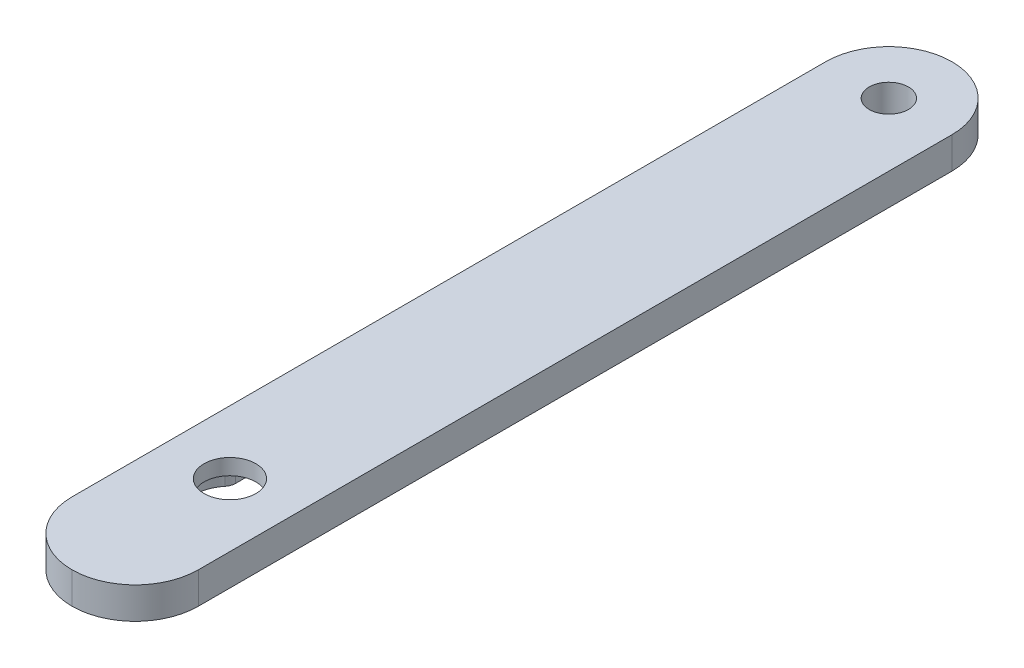
from build123d import *

# Parameters (mm, degrees)
SKETCH1_W           = 15
SKETCH1_H           = 45
BOSS_EXTRUDE1_DEPTH = 2.2
SKETCH1_3_W         = 20
SKETCH1_3_H         = 50
SKETCH1_3_W_2       = 15
SKETCH1_3_H_2       = 45
BOSS_EXTRUDE2_DEPTH = 2.5
SKETCH1_4_W         = 20
SKETCH1_4_H         = 50
SKETCH1_4_R         = 4.1
BOSS_EXTRUDE3_DEPTH = 2.5
FILLET1_R           = 2
SKETCH1_5_R         = 3.1
BOSS_EXTRUDE4_DEPTH = 2.5
FILLET2_R           = 10
SKETCH2_R           = 3.1
CUT_EXTRUDE1_DEPTH  = 4


with BuildPart() as part:
    # Sketch1 → Boss-Extrude1 (new body)
    with BuildSketch(Plane(origin=(0, 0, 0), x_dir=(1, 0, 0), z_dir=(0, 1, 0))):
        Rectangle(SKETCH1_W, SKETCH1_H)
        with BuildLine():
            ThreePointArc((-3.894544437, -4.023993492), (-5.599998379, 0.004260474), (-3.88841703, 4.029914763))
            Line((-3.88841703, 4.029914763), (-3.88841703, 8.505312122))
            ThreePointArc((-3.88841703, 8.505312122), (-3.870707724, 8.925763598), (-3.817705253, 9.343236712))
            Line((-3.817705253, 9.343236712), (-2.664584371, 16.126741161))
            ThreePointArc((-2.664584371, 16.126741161), (-2.610617779, 16.555799687), (-2.593926654, 16.987916591))
            ThreePointArc((-2.593926654, 16.987916591), (0, 19.6), (2.606045235, 17.000007028))
            ThreePointArc((2.606045235, 17.000007028), (2.623754541, 16.579555552), (2.676757012, 16.162082438))
            Line((2.676757012, 16.162082438), (3.829877895, 9.378577989))
            ThreePointArc((3.829877895, 9.378577989), (3.882880366, 8.961104875), (3.900589672, 8.540653399))
            Line((3.900589672, 8.540653399), (3.900589672, 4.018133922))
            ThreePointArc((3.900589672, 4.018133922), (5.157678846, 2.181364004), (5.6, 0))
            ThreePointArc((5.6, 0), (5.156037667, -2.185240393), (3.894544437, -4.023993492))
            Line((3.894544437, -4.023993492), (3.894544437, -8.540646372))
            ThreePointArc((3.894544437, -8.540646372), (3.876835131, -8.961097847), (3.82383266, -9.378570962))
            Line((3.82383266, -9.378570962), (2.670711777, -16.16207541))
            ThreePointArc((2.670711777, -16.16207541), (2.617709306, -16.579548524), (2.6, -17))
            ThreePointArc((2.6, -17), (0, -19.6), (-2.6, -17))
            ThreePointArc((-2.6, -17), (-2.617709306, -16.579548524), (-2.670711777, -16.16207541))
            Line((-2.670711777, -16.16207541), (-3.82383266, -9.378570962))
            ThreePointArc((-3.82383266, -9.378570962), (-3.876835131, -8.961097847), (-3.894544437, -8.540646372))
            Line((-3.894544437, -8.540646372), (-3.894544437, -4.023993492))
        make_face(mode=Mode.SUBTRACT)
    extrude(amount=-BOSS_EXTRUDE1_DEPTH)

    # Sketch1<3> → Boss-Extrude2 (add)
    # profile 1 of 2: a face of its own
    with BuildSketch(Plane(origin=(0, 0, 0), x_dir=(1, 0, 0), z_dir=(0, 1, 0))):
        Rectangle(SKETCH1_3_W, SKETCH1_3_H)
        Rectangle(SKETCH1_3_W_2, SKETCH1_3_H_2, mode=Mode.SUBTRACT)
    # profile 2 of 2: a face of its own
    with BuildSketch(Plane(origin=(0, 0, 0), x_dir=(1, 0, 0), z_dir=(0, 1, 0))):
        Rectangle(SKETCH1_3_W_2, SKETCH1_3_H_2)
        with BuildLine():
            ThreePointArc((-3.894544437, -4.023993492), (-5.599998379, 0.004260474), (-3.88841703, 4.029914763))
            Line((-3.88841703, 4.029914763), (-3.88841703, 8.505312122))
            ThreePointArc((-3.88841703, 8.505312122), (-3.870707724, 8.925763598), (-3.817705253, 9.343236712))
            Line((-3.817705253, 9.343236712), (-2.664584371, 16.126741161))
            ThreePointArc((-2.664584371, 16.126741161), (-2.610617779, 16.555799687), (-2.593926654, 16.987916591))
            ThreePointArc((-2.593926654, 16.987916591), (0, 19.6), (2.606045235, 17.000007028))
            ThreePointArc((2.606045235, 17.000007028), (2.623754541, 16.579555552), (2.676757012, 16.162082438))
            Line((2.676757012, 16.162082438), (3.829877895, 9.378577989))
            ThreePointArc((3.829877895, 9.378577989), (3.882880366, 8.961104875), (3.900589672, 8.540653399))
            Line((3.900589672, 8.540653399), (3.900589672, 4.018133922))
            ThreePointArc((3.900589672, 4.018133922), (5.157678846, 2.181364004), (5.6, 0))
            ThreePointArc((5.6, 0), (5.156037667, -2.185240393), (3.894544437, -4.023993492))
            Line((3.894544437, -4.023993492), (3.894544437, -8.540646372))
            ThreePointArc((3.894544437, -8.540646372), (3.876835131, -8.961097847), (3.82383266, -9.378570962))
            Line((3.82383266, -9.378570962), (2.670711777, -16.16207541))
            ThreePointArc((2.670711777, -16.16207541), (2.617709306, -16.579548524), (2.6, -17))
            ThreePointArc((2.6, -17), (0, -19.6), (-2.6, -17))
            ThreePointArc((-2.6, -17), (-2.617709306, -16.579548524), (-2.670711777, -16.16207541))
            Line((-2.670711777, -16.16207541), (-3.82383266, -9.378570962))
            ThreePointArc((-3.82383266, -9.378570962), (-3.876835131, -8.961097847), (-3.894544437, -8.540646372))
            Line((-3.894544437, -8.540646372), (-3.894544437, -4.023993492))
        make_face(mode=Mode.SUBTRACT)
    extrude(amount=-BOSS_EXTRUDE2_DEPTH)

    # Sketch1<4> → Boss-Extrude3 (add)
    with BuildSketch(Plane(origin=(0, 0, 0), x_dir=(1, 0, 0), z_dir=(0, 1, 0))):
        Rectangle(SKETCH1_4_W, SKETCH1_4_H)
        with Locations(Location((0, 0, 0), (0, 0, 270))):
            Circle(SKETCH1_4_R, mode=Mode.SUBTRACT)
    extrude(amount=BOSS_EXTRUDE3_DEPTH)

    # Fillet1
    fillet1_edges = [part.edges().sort_by_distance(p)[0] for p in [
        (-3.88841703, -1.25, -4.029914763),
        (-3.894544437, -1.25, 4.023993492),
        (3.894544437, -1.25, 4.023993492),
        (3.900589672, -1.25, -4.018133922),
    ]]
    fillet(fillet1_edges, radius=FILLET1_R)

    # Sketch1<5> → Boss-Extrude4 (add, symmetric)
    with BuildSketch(Plane(origin=(0, 0, 0), x_dir=(1, 0, 0), z_dir=(0, 1, 0))):
        with BuildLine():
            ThreePointArc((-10, 104.3), (0, 114.3), (10, 104.3))
            Line((10, 104.3), (10, 25))
            Line((10, 25), (-10, 25))
            Line((-10, 25), (-10, 104.3))
        make_face()
        with Locations(Location((0, 104.3, 0), (0, 0, 270))):
            Circle(SKETCH1_5_R, mode=Mode.SUBTRACT)
    extrude(amount=BOSS_EXTRUDE4_DEPTH, both=True)

    # Fillet2
    fillet2_edges = [part.edges().sort_by_distance(p)[0] for p in [
        (10, 0, 25),
        (-10, 0, 25),
    ]]
    fillet(fillet2_edges, radius=FILLET2_R - 0.0001)  # a hair under: the kernel refuses the full size

    # Sketch2 → Cut-Extrude1 (cut)
    # profile 1 of 10: a face of its own
    with BuildSketch(Plane.XZ.offset(2.5)):
        with Locations(Location((0, -104.3, 0), (0, 0, 90))):
            Circle(SKETCH2_R)
    # profile 2 of 10: a face of its own
    with BuildSketch(Plane.XZ.offset(2.5)):
        Polygon((-3.086751346, -80.744870683), (5.873502692, -75.571665602), (5.873502692, -85.918075763), align=None)
        Polygon((-2.886751346, -80.744870683), (5.773502692, -75.744870683), (5.773502692, -85.744870683), align=None, mode=Mode.SUBTRACT)
    # profile 3 of 10: a face of its own
    with BuildSketch(Plane.XZ.offset(2.5)):
        Polygon((5.973502692, -88.744870683), (-2.986751346, -83.571665602), (-2.986751346, -93.918075763), align=None)
        Polygon((-2.886751346, -83.744870683), (-2.886751346, -93.744870683), (5.773502692, -88.744870683), align=None, mode=Mode.SUBTRACT)
    # profile 4 of 10: a face of its own
    with BuildSketch(Plane.XZ.offset(2.5)):
        Polygon((5.973502692, -72.744870683), (-2.986751346, -67.571665602), (-2.986751346, -77.918075763), align=None)
        Polygon((5.773502692, -72.744870683), (-2.886751346, -67.744870683), (-2.886751346, -77.744870683), align=None, mode=Mode.SUBTRACT)
    # profile 5 of 10: a face of its own
    with BuildSketch(Plane.XZ.offset(2.5)):
        Polygon((5.973502692, -56.744870683), (-2.986751346, -51.571665602), (-2.986751346, -61.918075763), align=None)
        Polygon((5.773502692, -56.744870683), (-2.886751346, -51.744870683), (-2.886751346, -61.744870683), align=None, mode=Mode.SUBTRACT)
    # profile 6 of 10: a face of its own
    with BuildSketch(Plane.XZ.offset(2.5)):
        Polygon((5.973502692, -40.744870683), (-2.986751346, -35.571665602), (-2.986751346, -45.918075763), align=None)
        Polygon((5.773502692, -40.744870683), (-2.886751346, -35.744870683), (-2.886751346, -45.744870683), align=None, mode=Mode.SUBTRACT)
    # profile 7 of 10: a face of its own
    with BuildSketch(Plane.XZ.offset(2.5)):
        Polygon((5.973502692, -24.744870683), (-2.986751346, -19.571665602), (-2.986751346, -29.918075763), align=None)
        Polygon((5.773502692, -24.744870683), (-2.886751346, -19.744870683), (-2.886751346, -29.744870683), align=None, mode=Mode.SUBTRACT)
    # profile 8 of 10: a face of its own
    with BuildSketch(Plane.XZ.offset(2.5)):
        Polygon((-3.086751346, -64.744870683), (5.873502692, -59.571665602), (5.873502692, -69.918075763), align=None)
        Polygon((5.773502692, -69.744870683), (-2.886751346, -64.744870683), (5.773502692, -59.744870683), align=None, mode=Mode.SUBTRACT)
    # profile 9 of 10: a face of its own
    with BuildSketch(Plane.XZ.offset(2.5)):
        Polygon((-3.086751346, -48.744870683), (5.873502692, -43.571665602), (5.873502692, -53.918075763), align=None)
        Polygon((5.773502692, -53.744870683), (-2.886751346, -48.744870683), (5.773502692, -43.744870683), align=None, mode=Mode.SUBTRACT)
    # profile 10 of 10: a face of its own
    with BuildSketch(Plane.XZ.offset(2.5)):
        Polygon((-3.086751346, -32.744870683), (5.873502692, -27.571665602), (5.873502692, -37.918075763), align=None)
        Polygon((5.773502692, -37.744870683), (-2.886751346, -32.744870683), (5.773502692, -27.744870683), align=None, mode=Mode.SUBTRACT)
    extrude(amount=-CUT_EXTRUDE1_DEPTH, mode=Mode.SUBTRACT)


solid = part.part
